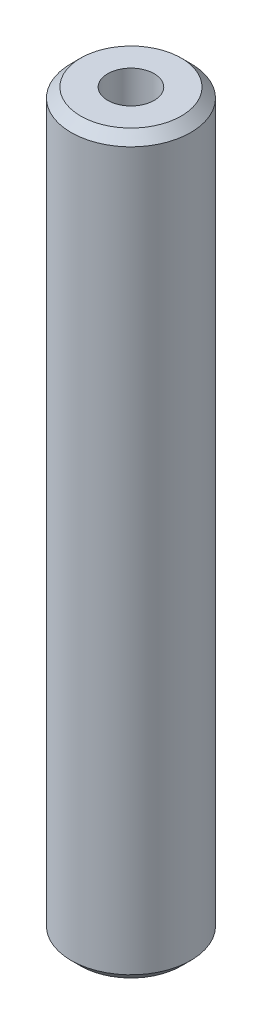
from build123d import *

# Parameters (mm, degrees)
SKETCH1_R           = 12.5
BOSS_EXTRUDE1_DEPTH = 153.86178006
SKETCH2_R           = 4.850605909
CUT_EXTRUDE1_DEPTH  = 155.873972517
CHAMFER1_SIZE       = 1.991440869


with BuildPart() as part:
    # Sketch1 → Boss-Extrude1 (new body)
    with BuildSketch(Plane(origin=(0, 0, 0), x_dir=(1, 0, 0), z_dir=(0, 1, 0))):
        Circle(SKETCH1_R)
    extrude(amount=BOSS_EXTRUDE1_DEPTH)

    # Sketch2 → Cut-Extrude1 (cut, through all)
    with BuildSketch(Plane(origin=(0, 0, 0), x_dir=(1, 0, 0), z_dir=(0, 1, 0))):
        Circle(SKETCH2_R)
    extrude(amount=CUT_EXTRUDE1_DEPTH, mode=Mode.SUBTRACT)

    # Chamfer1
    chamfer1_edges = [part.edges().sort_by_distance(p)[0] for p in [
        (-12.5, 153.86178006, 0),
        (-12.5, 0, 0),
    ]]
    chamfer(chamfer1_edges, length=CHAMFER1_SIZE)


solid = part.part
